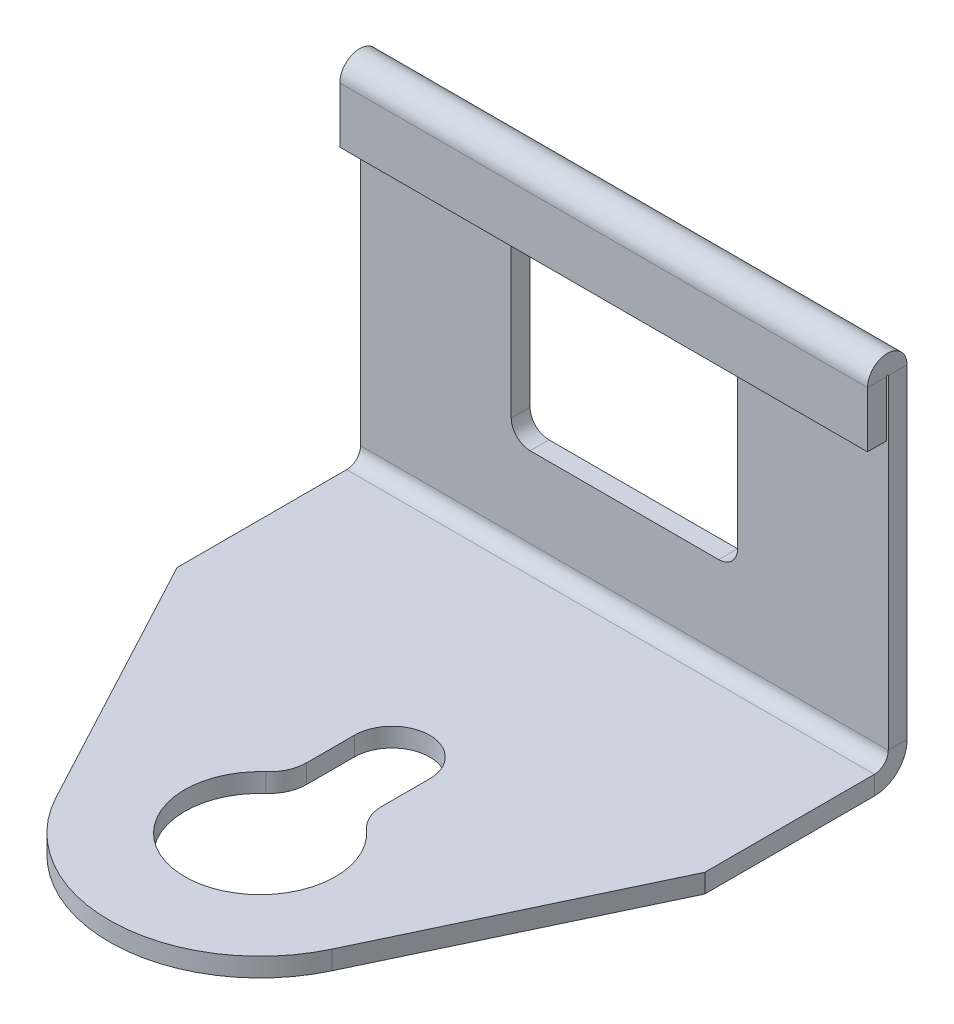
from build123d import *

# Parameters (mm, degrees)
BASE_FLANGE1_DEPTH = 1
EDGE_FLANGE1_DEPTH = 28
HEM1_START         = -14
HEM1_DEPTH         = 28
HEM1_2_DEPTH       = 28
CUT_EXTRUDE1_DEPTH = 10
CUT_EXTRUDE3_DEPTH = 10


# Read off the part's stored shape, not the designer's step: Hem1
# Sheet-metal steps are written as plain solids
with BuildPart() as part:
    # Sketch1 → Base-Flange1 (new body)
    with BuildSketch(Plane(origin=(0, 0, 0), x_dir=(1, 0, 0), z_dir=(0, 1, 0))):
        with BuildLine():
            Line((-14, 0), (14, 0))
            Line((14, 0), (14, -9))
            Line((14, -9), (7.635806501, -22.426557457))
            ThreePointArc((7.635806501, -22.426557457), (0.597605148, -26.997723985), (-6.650589662, -22.767415048))
            Line((-6.650589662, -22.767415048), (-14, -9))
            Line((-14, -9), (-14, 0))
        make_face()
    extrude(amount=-BASE_FLANGE1_DEPTH)

    # Edge-Flange1 section (across the edge) → Edge-Flange1 (add)
    with BuildSketch(Plane(origin=(14, 0, -0.7366), x_dir=(0, 0, 1), z_dir=(-1, 0, 0))):
        with BuildLine():
            Line((-1, 0.7366), (-1, 19))
            Line((-1, 19), (0, 19))
            Line((0, 19), (0, 0.7366))
            ThreePointArc((0, 0.7366), (0.215745145, 0.215745145), (0.7366, 0))
            Line((0.7366, 0), (0.7366, -1))
            ThreePointArc((0.7366, -1), (-0.491361636, -0.491361636), (-1, 0.7366))
        make_face()
    extrude(amount=EDGE_FLANGE1_DEPTH)

    # Hem1 outline → Hem1 (cut)
    with BuildSketch(Plane.YZ.offset(HEM1_START)):
        with BuildLine():
            Line((19, -0.7366), (18.998808848, -0.7366))
            ThreePointArc((18.998808848, -0.7366), (18.674568837, -1.446534208), (17.95, -1.7366))
            Line((17.95, -1.7366), (19, -1.7366))
            Line((19, -1.7366), (19, -0.7366))
        make_face()
    extrude(amount=HEM1_DEPTH, mode=Mode.SUBTRACT)

    # Hem1 2 outline → Hem1 2 (add)
    with BuildSketch(Plane.YZ.offset(HEM1_START)):
        with BuildLine():
            Line((15, 0.3634), (15, -0.6366))
            Line((15, -0.6366), (17.95, -0.6366))
            ThreePointArc((17.95, -0.6366), (18, -0.6866), (17.95, -0.7366))
            Line((17.95, -0.7366), (18.998808848, -0.7366))
            ThreePointArc((18.998808848, -0.7366), (18.709934208, 0.037968837), (17.95, 0.3634))
            Line((17.95, 0.3634), (15, 0.3634))
        make_face()
    extrude(amount=HEM1_2_DEPTH)

    # Sketch15 → Cut-Extrude1 (cut)
    with BuildSketch(Plane.XY.offset(-0.7366)):
        with BuildLine():
            Line((-5.004090335, 15.057117645), (5.004090335, 15.057117645))
            ThreePointArc((5.004090335, 15.057117645), (5.711197117, 14.764224427), (6.004090335, 14.057117645))
            Line((6.004090335, 14.057117645), (6.004090335, 6))
            ThreePointArc((6.004090335, 6), (5.711197117, 5.292893219), (5.004090335, 5))
            Line((5.004090335, 5), (-5.004090335, 5))
            ThreePointArc((-5.004090335, 5), (-5.711197117, 5.292893219), (-6.004090335, 6))
            Line((-6.004090335, 6), (-6.004090335, 14.057117645))
            ThreePointArc((-6.004090335, 14.057117645), (-5.711197117, 14.764224427), (-5.004090335, 15.057117645))
        make_face()
    extrude(amount=-CUT_EXTRUDE1_DEPTH, mode=Mode.SUBTRACT)

    # Sketch16 → Cut-Extrude3 (cut)
    with BuildSketch(Plane(origin=(0, 0, 0), x_dir=(1, 0, 0), z_dir=(0, 1, 0))):
        with BuildLine():
            Line((-1.593211689, -12), (-1.593211689, -14.527864045))
            ThreePointArc((-1.593211689, -14.527864045), (-1.767469831, -15.344360626), (-2.259878356, -16.01857603))
            ThreePointArc((-2.259878356, -16.01857603), (0.406788311, -23), (3.073454977, -16.01857603))
            ThreePointArc((3.073454977, -16.01857603), (2.581046452, -15.344360626), (2.406788311, -14.527864045))
            Line((2.406788311, -14.527864045), (2.406788311, -12))
            ThreePointArc((2.406788311, -12), (0.406788311, -10), (-1.593211689, -12))
        make_face()
    extrude(amount=-CUT_EXTRUDE3_DEPTH, mode=Mode.SUBTRACT)


solid = part.part
